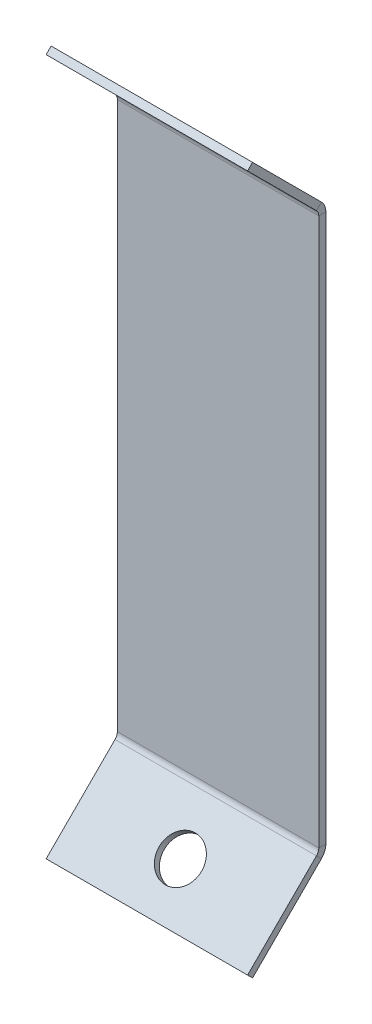
from build123d import *

# Parameters (mm, degrees)
SKETCH1_W                    = 20
SKETCH1_H                    = 55
BASE_FLANGE1_DEPTH           = 0.7
EDGE_FLANGE1_STRIP_CUT_DEPTH = 20
EDGE_FLANGE1_DEPTH           = 20
EDGE_FLANGE2_STRIP_CUT_DEPTH = 20
EDGE_FLANGE2_DEPTH           = 20
F_19_0_166_DIAMETER_SLOT1_D  = 4.2164
F_19_0_166_DIAMETER_SLOT2_D  = 4.2164


# Sheet-metal steps are written as plain solids
with BuildPart() as part:
    # Sketch1 → Base-Flange1 (new body)
    with BuildSketch(Plane.XY):
        Rectangle(SKETCH1_W, SKETCH1_H)
    extrude(amount=-BASE_FLANGE1_DEPTH)

    # Edge-Flange1 strip (across the edge) → Edge-Flange1 strip cut (cut)
    with BuildSketch(Plane(origin=(-10, -27.5, 0), x_dir=(0, 0.7071067811865438, 0.7071067811865512), z_dir=(1, 0, 0))):
        Polygon((-3.371930009, 2.381980515), (-0.260660172, -0.729289322), (0.234314575, -0.234314575), (-2.876955262, 2.876955262), align=None)
    extrude(amount=EDGE_FLANGE1_STRIP_CUT_DEPTH, mode=Mode.SUBTRACT)

    # Edge-Flange1 section (across the edge) → Edge-Flange1 (add)
    with BuildSketch(Plane(origin=(-10, -27.5, 0), x_dir=(0, 0.7071067811865438, 0.7071067811865512), z_dir=(1, 0, 0))):
        with BuildLine():
            Line((-0.7, 0.33137085), (-0.7, 10))
            Line((-0.7, 10), (0, 10))
            Line((0, 10), (0, 0.33137085))
            ThreePointArc((0, 0.33137085), (0.060896374, 0.025224104), (0.234314575, -0.234314575))
            Line((0.234314575, -0.234314575), (-0.260660172, -0.729289322))
            ThreePointArc((-0.260660172, -0.729289322), (-0.585819299, -0.242654299), (-0.7, 0.33137085))
        make_face()
    extrude(amount=EDGE_FLANGE1_DEPTH)

    # Edge-Flange2 strip (across the edge) → Edge-Flange2 strip cut (cut)
    with BuildSketch(Plane(origin=(10, 27.5, 0), x_dir=(0, -0.7071067811865438, 0.7071067811865512), z_dir=(-1, 0, 0))):
        Polygon((-3.371930009, 2.381980515), (-0.260660172, -0.729289322), (0.234314575, -0.234314575), (-2.876955262, 2.876955262), align=None)
    extrude(amount=EDGE_FLANGE2_STRIP_CUT_DEPTH, mode=Mode.SUBTRACT)

    # Edge-Flange2 section (across the edge) → Edge-Flange2 (add)
    with BuildSketch(Plane(origin=(10, 27.5, 0), x_dir=(0, -0.7071067811865438, 0.7071067811865512), z_dir=(-1, 0, 0))):
        with BuildLine():
            Line((-0.7, 0.33137085), (-0.7, 10))
            Line((-0.7, 10), (0, 10))
            Line((0, 10), (0, 0.33137085))
            ThreePointArc((0, 0.33137085), (0.060896374, 0.025224104), (0.234314575, -0.234314575))
            Line((0.234314575, -0.234314575), (-0.260660172, -0.729289322))
            ThreePointArc((-0.260660172, -0.729289322), (-0.585819299, -0.242654299), (-0.7, 0.33137085))
        make_face()
    extrude(amount=EDGE_FLANGE2_DEPTH)

    # #19 (0.166) Diameter Slot1 (through all)
    with Locations(Plane(origin=(0, -13.75, -13.75), x_dir=(1, 0, 0), z_dir=(0, 0.7071067811865438, 0.7071067811865513))):
        with Locations((0, -24.738773453)):
            Hole(F_19_0_166_DIAMETER_SLOT1_D / 2)

    # #19 (0.166) Diameter Slot2 (through all)
    with Locations(Plane(origin=(0, 13.75, -13.75), x_dir=(1, 0, 0), z_dir=(0, -0.7071067811865441, 0.7071067811865509))):
        with Locations((0, 24.940163898)):
            Hole(F_19_0_166_DIAMETER_SLOT2_D / 2)


solid = part.part
